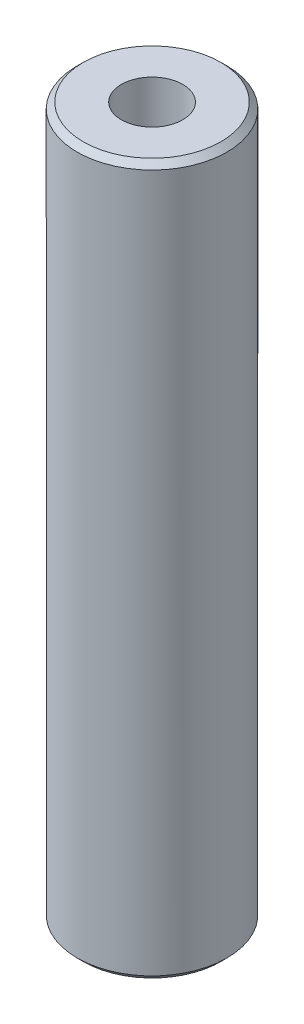
from build123d import *
from OCP.BRepFilletAPI import BRepFilletAPI_MakeChamfer

# Parameters (mm, degrees)
SKETCH1_R           = 52.5
BOSS_EXTRUDE1_DEPTH = 498.019441746
SKETCH2_R           = 21.532078541
CUT_EXTRUDE1_DEPTH  = 504.52344966
CHAMFER1_SIZE       = 4.187483347
CHAMFER1_SIZE2      = 4.227203435


with BuildPart() as part:
    # Sketch1 → Boss-Extrude1 (new body)
    with BuildSketch(Plane(origin=(0, 0, 0), x_dir=(1, 0, 0), z_dir=(0, 1, 0))):
        Circle(SKETCH1_R)
    extrude(amount=BOSS_EXTRUDE1_DEPTH)

    # Sketch2 → Cut-Extrude1 (cut, through all)
    with BuildSketch(Plane(origin=(0, 0, 0), x_dir=(1, 0, 0), z_dir=(0, 1, 0))):
        Circle(SKETCH2_R)
    extrude(amount=CUT_EXTRUDE1_DEPTH, mode=Mode.SUBTRACT)

    # Chamfer1: one chamfer whose edges measure the first distance from different faces: ONE call of the kernel's chamfer builder (chamfer() names one face for all edges)
    chamfer1_edges_1 = [part.edges().sort_by_distance(p)[0] for p in [
        (-52.5, 498.019441746, 0),
    ]]
    chamfer1_side_1 = [part.faces().sort_by_distance(p)[0] for p in [
        (-52.5, 249.009720873, 0),
    ]]
    chamfer1_edges_2 = [part.edges().sort_by_distance(p)[0] for p in [
        (-52.5, 0, 0),
    ]]
    chamfer1_side_2 = [part.faces().sort_by_distance(p)[0] for p in [
        (-51.01507576, 0, 0),
    ]]
    chamfer1 = BRepFilletAPI_MakeChamfer(part.part.solid().wrapped)
    for e in chamfer1_edges_1:
        chamfer1.Add(CHAMFER1_SIZE, CHAMFER1_SIZE2, e.wrapped, chamfer1_side_1[0].wrapped)  # the first distance lies on this face
    for e in chamfer1_edges_2:
        chamfer1.Add(CHAMFER1_SIZE, CHAMFER1_SIZE2, e.wrapped, chamfer1_side_2[0].wrapped)  # the first distance lies on this face
    add(Compound.cast(chamfer1.Shape()), mode=Mode.REPLACE)


solid = part.part
